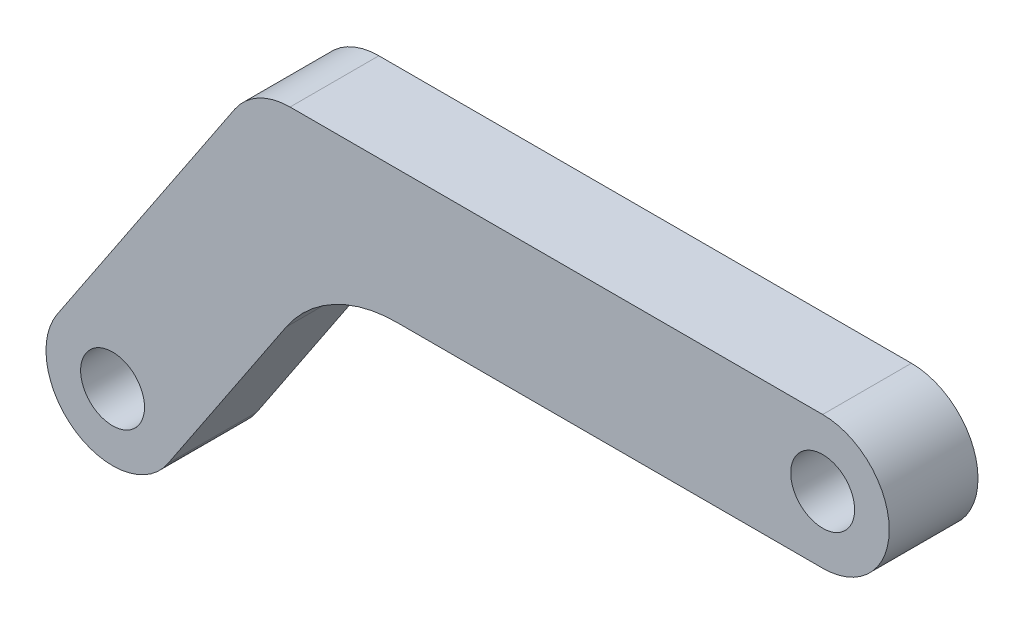
from build123d import *

# Parameters (mm, degrees)
SKETCH1_R           = 2.286
BOSS_EXTRUDE1_DEPTH = 6.35


with BuildPart() as part:
    # Sketch1 → Boss-Extrude1 (new body)
    with BuildSketch(Plane.XY):
        with BuildLine():
            Line((-54.762639527, -16.408240315), (-42.062639527, 2.641759685))
            ThreePointArc((-42.062639527, 2.641759685), (-40.34722337, 4.198975277), (-38.1, 4.7625))
            Line((-38.1, 4.7625), (0, 4.7625))
            ThreePointArc((0, 4.7625), (4.7625, 0), (0, -4.7625))
            Line((0, -4.7625), (-30.453562051, -4.7625))
            ThreePointArc((-30.453562051, -4.7625), (-34.948008791, -5.889549447), (-38.378841104, -9.003980631))
            Line((-38.378841104, -9.003980631), (-46.837360473, -21.691759685))
            ThreePointArc((-46.837360473, -21.691759685), (-53.441759685, -23.012639527), (-54.762639527, -16.408240315))
        make_face()
        Circle(SKETCH1_R, mode=Mode.SUBTRACT)
        with Locations((-50.8, -19.05)):
            Circle(SKETCH1_R, mode=Mode.SUBTRACT)
    extrude(amount=BOSS_EXTRUDE1_DEPTH)


solid = part.part
